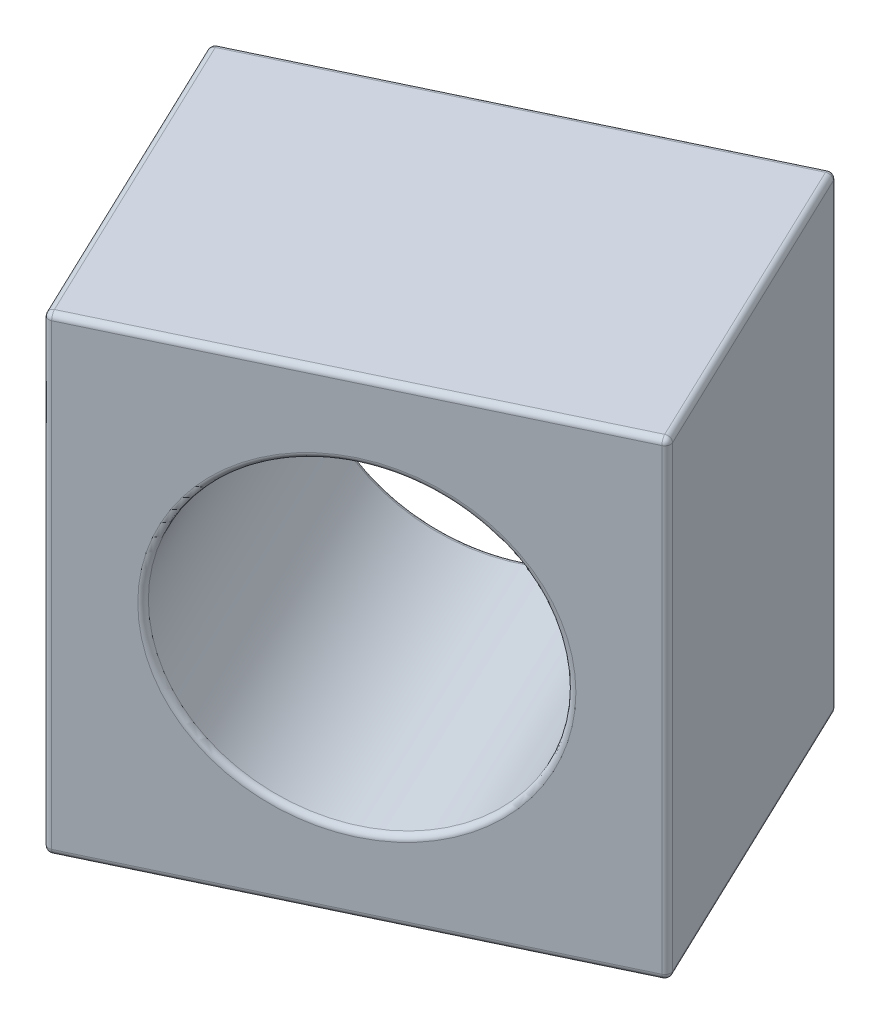
from build123d import *

# Parameters (mm, degrees)
BOSS_EXTRUDE1_DEPTH      = 20
BOSS_EXTRUDE1_DEPTH_BACK = 20
CUT_SWEEP1_PROFILE_R     = 13.5
CUT_SWEEP2_PROFILE_R     = 6
FILLET1_R                = 0.5


with BuildPart() as part:
    # Sketch19 → Boss-Extrude1 (new, two sides: drawn at the far end of the back side and taken through both)
    with BuildSketch(Plane(origin=(0, 0, 0), x_dir=(1, 0, 0), z_dir=(0, 1, 0)).offset(-BOSS_EXTRUDE1_DEPTH_BACK)):
        Polygon((134.915401848, 322.806168715), (138.300353153, 321.192289952), (125.389323054, 294.112679509), (122.004371748, 295.726558271), (89.283175796, 311.327386308), (102.194205895, 338.406996751), align=None)
    extrude(amount=BOSS_EXTRUDE1_DEPTH + BOSS_EXTRUDE1_DEPTH_BACK)

    # Cut-Sweep1: sweep along a path in Sketch5
    with BuildLine(Plane(origin=(0, 0, 0), x_dir=(1, 0, 0), z_dir=(0, 1, 0))) as cut_sweep1_path:
        Line((15.451096543, 110), (223.369661717, 546.088654867))
    # Cut-Sweep1 profile (on start of the path) → Cut-Sweep1 (sweep, cut)
    with BuildSketch(Plane(origin=(15.451096543, 0, -110), x_dir=(-0.9026536814530927, 0, -0.43036766997438236), z_dir=(0.43036766997438236, 0, -0.9026536814530927))):
        Circle(CUT_SWEEP1_PROFILE_R)
    sweep(path=cut_sweep1_path.line, mode=Mode.SUBTRACT)

    # Cut-Sweep2: sweep along a path in Sketch33
    with BuildLine(Plane(origin=(0, 0, 0), x_dir=(1, 0, 0), z_dir=(0, 1, 0))) as cut_sweep2_path:
        Line((128.459886798, 309.266363493), (271.805005174, 137.491575647))
    # Cut-Sweep2 profile (on start of the path) → Cut-Sweep2 (sweep, cut)
    with BuildSketch(Plane(origin=(128.459886798, 0, -309.266363493), x_dir=(0.767782639292157, 0, -0.6407104016648784), z_dir=(0.6407104016648784, 0, 0.767782639292157))):
        Circle(CUT_SWEEP2_PROFILE_R)
    sweep(path=cut_sweep2_path.line, mode=Mode.SUBTRACT)

    # Fillet1
    fillet1_edges = [part.edges().sort_by_distance(p)[0] for p in [
        (132.433104224, 0, -323.989679807),
        (120.247279524, -20, -329.799643352),
        (107.336249425, -20, -302.720032908),
        (119.522074124, 0, -296.910069363),
        (131.844838103, -20, -307.65248473),
        (125.389323054, 0, -294.112679509),
        (138.300353153, 0, -321.192289952),
        (128.262320501, -7.134e-05, -300.138507895),
        (131.844838103, 20, -307.65248473),
        (107.336249425, 20, -302.720032908),
        (120.247279524, 20, -329.799643352),
        (95.738690845, -20, -324.867191529),
        (102.194205895, 0, -338.406996751),
        (95.738690845, 20, -324.867191529),
        (89.283175796, 0, -311.327386308),
    ]]
    fillet(fillet1_edges, radius=FILLET1_R)


with BuildPart() as body_2:
    # Mirror2: mirrored copy
    add(part.part.mirror(Plane(origin=(0, 0, 0), x_dir=(0, 0, 1), z_dir=(1, 0, 0))))


solid = body_2.part
